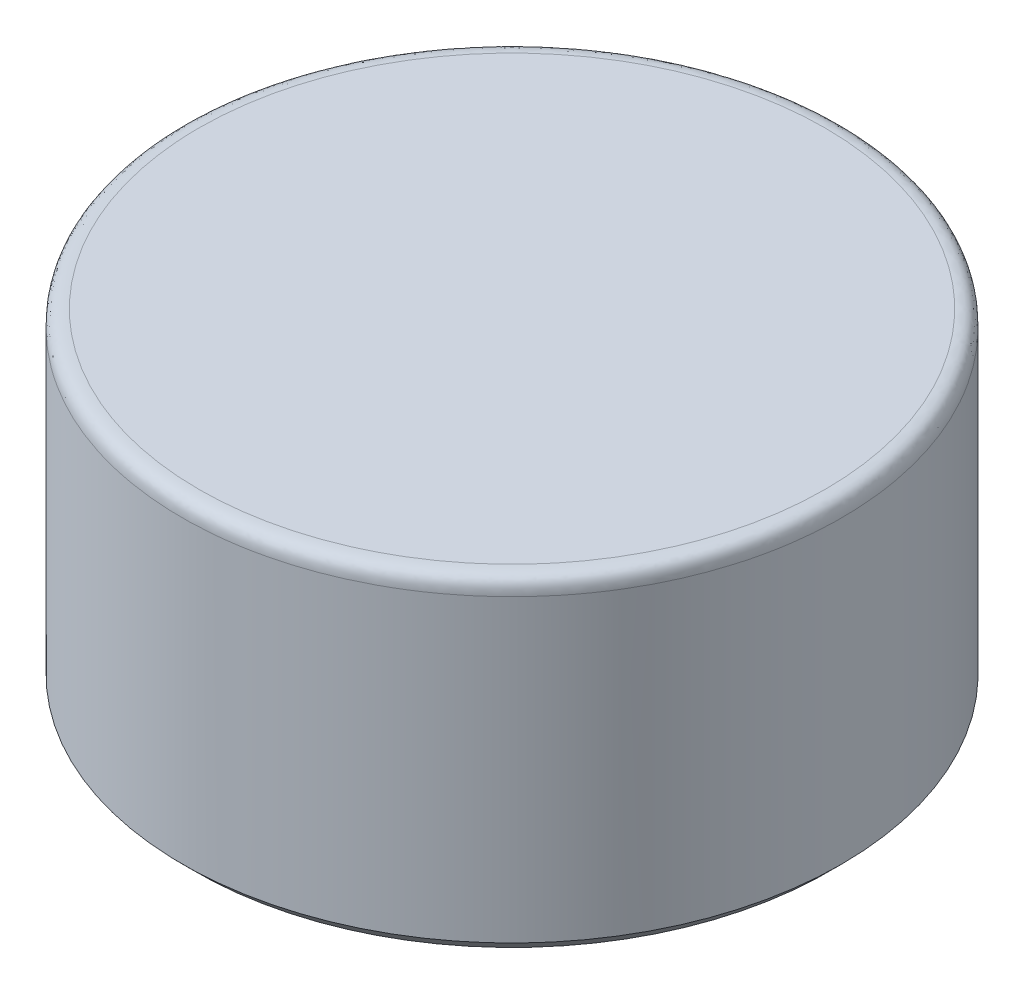
from build123d import *

# Parameters (mm, degrees)
FILLET1_SIZE  = 0.5
CHAMFER1_SIZE = 0.4


with BuildPart() as part:
    # Sketch1 → Revolve1 (revolve)
    with BuildSketch(Plane.XY, mode=Mode.PRIVATE) as revolve1_sk:
        Polygon((10, 0), (10, 10), (0, 10), (0, 9), (9, 9), (9, 0), align=None)
    revolve(revolve1_sk.sketch.rotate(Axis((0, 10, 0), (0, -1, 0)), 180), axis=Axis((0, 10, 0), (0, -1, 0)))

    # Fillet1
    # a fillet whose section is not a circle: 0.5 mm, written as the material it takes off along each edge
    with BuildSketch(Plane(origin=(0, 10, 0), x_dir=(-1, 0, 0), z_dir=(0, 0, 1))) as fillet1_piece_1:
        with BuildLine():
            add(Edge.make_bspline([(10, FILLET1_SIZE), (10, FILLET1_SIZE * 0.831801948466), (10, FILLET1_SIZE * 0.663603896932), (10 - FILLET1_SIZE * 0.0716919198361, FILLET1_SIZE * 0.292893218813), (10 - FILLET1_SIZE * 0.292893218813, FILLET1_SIZE * 0.0716919198361), (10 - FILLET1_SIZE * 0.663603896932, 0), (10 - FILLET1_SIZE * 0.831801948466, 0), (10 - FILLET1_SIZE, 0)], knots=[0, 0, 0, 0, 0, 0, 0.5, 0.5, 1, 1, 1, 1, 1, 1], degree=5))
            Line((10 - FILLET1_SIZE, 0), (10, 0))
            Line((10, 0), (10, FILLET1_SIZE))
        make_face()
    revolve(axis=Axis((0, 10, 0), (0, -1, 0)), mode=Mode.SUBTRACT)

    # Chamfer1
    chamfer1_edges = [part.edges().sort_by_distance(p)[0] for p in [
        (10, 0, 0),
    ]]
    chamfer(chamfer1_edges, length=CHAMFER1_SIZE)


solid = part.part
